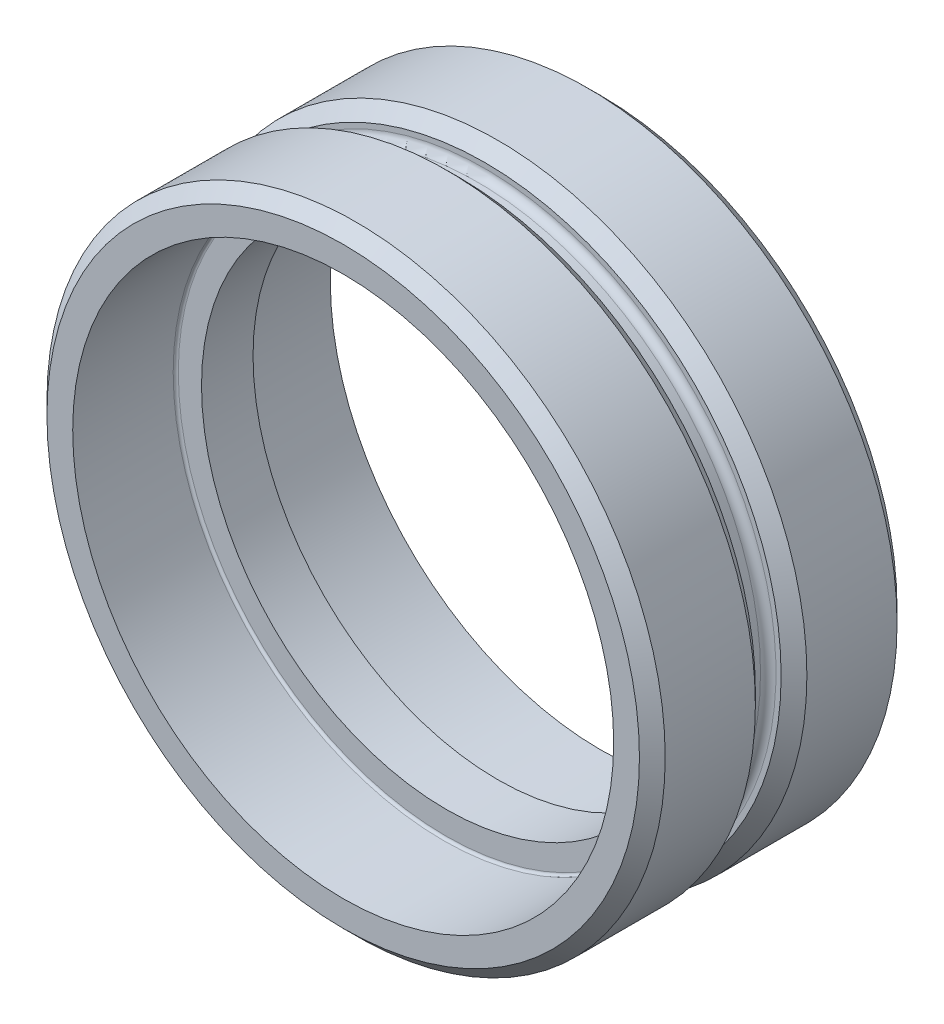
from build123d import *

# Parameters (mm, degrees)
FILLET_1_R     = 0.3
CHAMFER_1_SIZE = 0.5
FILLET_2_R     = 0.1


with BuildPart() as part:
    # Эскиз18 → Повернуть1 (revolve)
    with BuildSketch(Plane(origin=(0, 0, 0), x_dir=(0, 0, -1), z_dir=(1, 0, 0))):
        Polygon((-10, -10.5), (-6, -10.5), (-6, -9.5), (-4, -9.5), (-4, -10.5), (0, -10.5), (0, -12), (-4.5, -12), (-4.5, -11), (-5.5, -11), (-5.5, -12), (-10, -12), align=None)
    revolve(axis=Axis((0, 0, 0), (0, 0, 1)))

    # Скругление1
    fillet_1_edges = [part.edges().sort_by_distance(p)[0] for p in [
        (0, 11, 4.5),
        (0, 11, 5.5),
    ]]
    fillet(fillet_1_edges, radius=FILLET_1_R)

    # Фаска1
    chamfer_1_edges = [part.edges().sort_by_distance(p)[0] for p in [
        (0, 12, 4.5),
        (0, 12, 0),
        (0, 12, 10),
        (0, 12, 5.5),
    ]]
    chamfer(chamfer_1_edges, length=CHAMFER_1_SIZE)

    # Скругление2
    fillet_2_edges = [part.edges().sort_by_distance(p)[0] for p in [
        (0, 10.5, 6),
        (0, 10.5, 4),
    ]]
    fillet(fillet_2_edges, radius=FILLET_2_R)


solid = part.part
